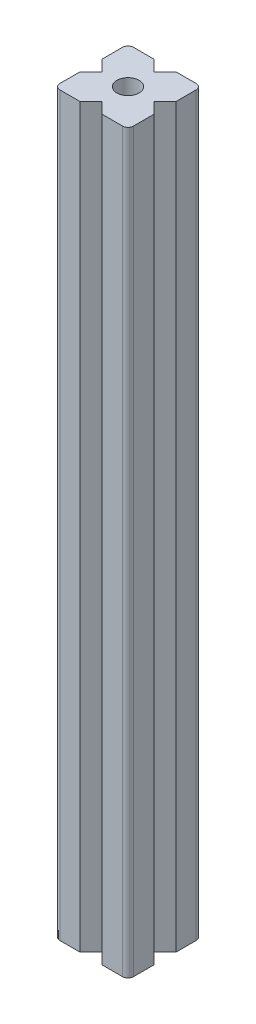
from build123d import *

# Parameters (mm, degrees)
SKIZZE1_W                       = 20
SKIZZE1_H                       = 20
AUFSATZ_LINEAR_AUSTRAGEN1_DEPTH = 200
SCHNITT_LINEAR_AUSTRAGEN1_DEPTH = 202.990098767
SKIZZE3_R                       = 3
SCHNITT_LINEAR_AUSTRAGEN2_DEPTH = 202.990098767
FILLET1_R                       = 1.5


with BuildPart() as part:
    # Skizze1 → Aufsatz-Linear austragen1 (new body)
    with BuildSketch(Plane(origin=(0, 0, 0), x_dir=(1, 0, 0), z_dir=(0, 1, 0))):
        with Locations((10, 10)):
            Rectangle(SKIZZE1_W, SKIZZE1_H)
    extrude(amount=AUFSATZ_LINEAR_AUSTRAGEN1_DEPTH)

    # Skizze2 → Schnitt-Linear austragen1 (cut, through all)
    with BuildSketch(Plane(origin=(0, 200, 0), x_dir=(1, 0, 0), z_dir=(0, 1, 0))):
        Polygon((7, 20), (10, 17), (13, 20), align=None)
        Polygon((20, 13), (17, 10), (20, 7), align=None)
        Polygon((0, 7), (0, 13), (3, 10), align=None)
        Polygon((7, 0), (13, 0), (10, 3), align=None)
    extrude(amount=-SCHNITT_LINEAR_AUSTRAGEN1_DEPTH, mode=Mode.SUBTRACT)

    # Skizze3 → Schnitt-Linear austragen2 (cut, through all)
    with BuildSketch(Plane(origin=(0, 200, 0), x_dir=(1, 0, 0), z_dir=(0, 1, 0))):
        with Locations((10, 10)):
            Circle(SKIZZE3_R)
    extrude(amount=-SCHNITT_LINEAR_AUSTRAGEN2_DEPTH, mode=Mode.SUBTRACT)

    # Fillet1
    fillet1_edges = [part.edges().sort_by_distance(p)[0] for p in [
        (20, 100, 0),
        (20, 100, -20),
        (0, 100, -20),
        (0, 100, 0),
    ]]
    fillet(fillet1_edges, radius=FILLET1_R)


solid = part.part
